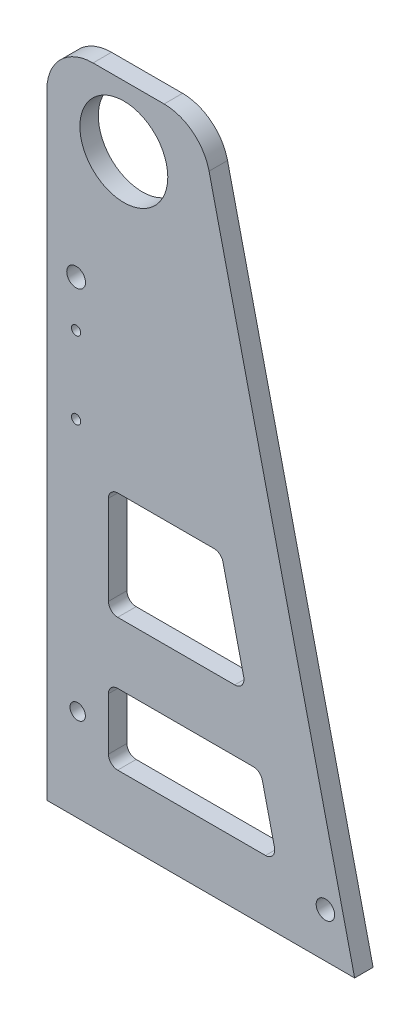
from build123d import *

# Parameters (mm, degrees)
ESBO_O1_R                = 14.2875
ESBO_O1_R_2              = 2.5
RESSALTO_EXTRUS_O2_DEPTH = 6
FILETE1_R                = 15
ESBO_O3_R                = 1.5
ESBO_O3_R_2              = 3
ESBO_O3_R_3              = 3.05
CORTE_EXTRUS_O1_DEPTH    = 238.194013415


with BuildPart() as part:
    # Esboço1 → Ressalto-extrusão2 (new body)
    with BuildSketch(Plane.XY):
        Polygon((0, 0), (0, 215), (50, 215), (100, 0), align=None)
        with Locations((25, 195)):
            Circle(ESBO_O1_R, mode=Mode.SUBTRACT)
        with Locations((10, 30)):
            Circle(ESBO_O1_R_2, mode=Mode.SUBTRACT)
        with BuildLine():
            Line((20, 95), (20, 66))
            ThreePointArc((20, 66), (20.878679656, 63.878679656), (23, 63))
            Line((23, 63), (61.03739436, 63))
            ThreePointArc((61.03739436, 63), (63.386715693, 64.134339454), (63.959418441, 66.679540484))
            Line((63.959418441, 66.679540484), (57.215232395, 95.679540484))
            ThreePointArc((57.215232395, 95.679540484), (56.15886886, 97.349321333), (54.293208314, 98))
            Line((54.293208314, 98), (23, 98))
            ThreePointArc((23, 98), (20.878679656, 97.121320344), (20, 95))
        make_face(mode=Mode.SUBTRACT)
        with BuildLine():
            Line((20, 40), (20, 23))
            ThreePointArc((20, 23), (20.878679656, 20.878679656), (23, 20))
            Line((23, 20), (71.03739436, 20))
            ThreePointArc((71.03739436, 20), (73.386715693, 21.134339454), (73.959418441, 23.679540484))
            Line((73.959418441, 23.679540484), (70.005930069, 40.679540484))
            ThreePointArc((70.005930069, 40.679540484), (68.949566534, 42.349321333), (67.083905988, 43))
            Line((67.083905988, 43), (23, 43))
            ThreePointArc((23, 43), (20.878679656, 42.121320344), (20, 40))
        make_face(mode=Mode.SUBTRACT)
    extrude(amount=RESSALTO_EXTRUS_O2_DEPTH)

    # Filete1
    filete1_edges = [part.edges().sort_by_distance(p)[0] for p in [
        (0, 215, 3),
        (50, 215, 3),
    ]]
    fillet(filete1_edges, radius=FILETE1_R)

    # Esboço3 → Corte-extrusão1 (cut, through all)
    with BuildSketch(Plane(origin=(0, 0, 0), x_dir=(-1, 0, 0), z_dir=(0, 0, -1))):
        with Locations((-9.5, 112)):
            Circle(ESBO_O3_R)
        with Locations((-90.5, 14.5)):
            Circle(ESBO_O3_R_2)
        with Locations((-9.5, 137)):
            Circle(ESBO_O3_R)
        with Locations((-9.5, 152)):
            Circle(ESBO_O3_R_3)
    extrude(amount=-CORTE_EXTRUS_O1_DEPTH, mode=Mode.SUBTRACT)


solid = part.part
